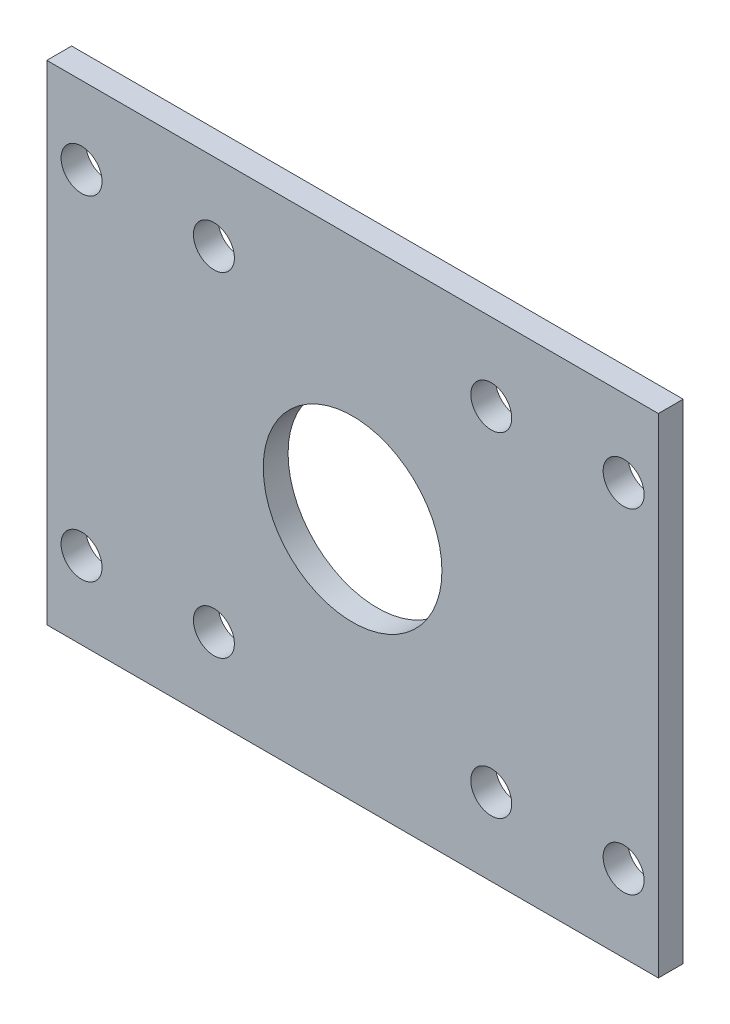
from build123d import *

# Parameters (mm, degrees)
SKETCH2_R           = 7.2
SKETCH2_R_2         = 1.65
SKETCH2_R_3         = 1.651428811
BOSS_EXTRUDE1_DEPTH = 2


with BuildPart() as part:
    # Sketch2 → Boss-Extrude1 (new body)
    with BuildSketch(Plane.XY):
        Polygon((-24.644714029, -19.696955549), (24.644714029, -19.703045377), (24.644714029, 19.696955549), (-24.644714029, 19.703045377), align=None)
        Circle(SKETCH2_R, mode=Mode.SUBTRACT)
        with Locations((11.177204543, -13.465515163)):
            Circle(SKETCH2_R_2, mode=Mode.SUBTRACT)
        with Locations((-11.177204543, -13.465515163)):
            Circle(SKETCH2_R_2, mode=Mode.SUBTRACT)
        with Locations((-11.177204543, 13.465515163)):
            Circle(SKETCH2_R_2, mode=Mode.SUBTRACT)
        with Locations((11.177204543, 13.465515163)):
            Circle(SKETCH2_R_2, mode=Mode.SUBTRACT)
        with Locations((-21.844514318, 13.465515163)):
            Circle(SKETCH2_R_3, mode=Mode.SUBTRACT)
        with Locations((-21.844514318, -13.465515163)):
            Circle(SKETCH2_R_3, mode=Mode.SUBTRACT)
        with Locations((21.844514318, -13.465515163)):
            Circle(SKETCH2_R_3, mode=Mode.SUBTRACT)
        with Locations((21.844514318, 13.465515163)):
            Circle(SKETCH2_R_3, mode=Mode.SUBTRACT)
    extrude(amount=BOSS_EXTRUDE1_DEPTH)


solid = part.part
